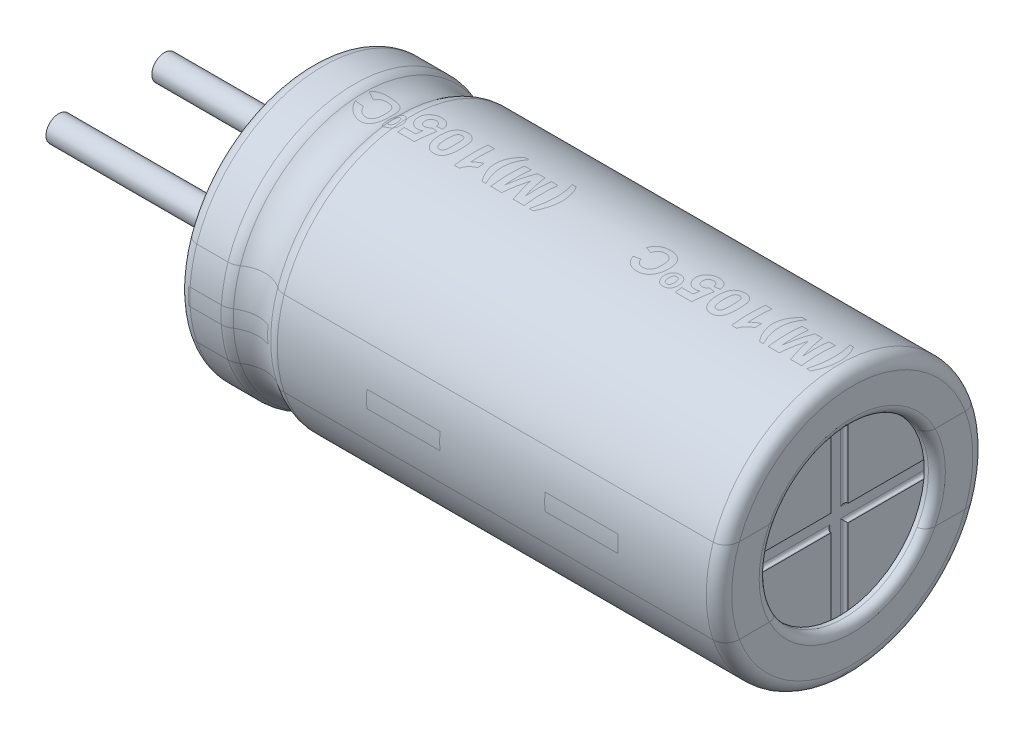
from build123d import *

# Parameters (mm, degrees)
FILLET_1_R          = 0.4
SKETCH_2_R          = 2
CUT_EXTRUDE_1_DEPTH = 0.3
FILLET_2_R          = 0.2
FILLET_3_R          = 0.3
CUT_EXTRUDE_2_DEPTH = 0.1
CUT_EXTRUDE_START   = -0.3
SKETCH_5_R          = 2
CUT_EXTRUDE_3_DEPTH = 0.3
FILLET_6_R          = 0.3
SKETCH_6_R          = 0.3
EXTRUDE_1_DEPTH     = 5
FILLET_7_R          = 0.08


with BuildPart() as part:
    # Эскиз1 → Повернуть1 (revolve)
    with BuildSketch(Plane(origin=(0, 0, 0), x_dir=(1, 0, 0), z_dir=(0, 1, 0)), mode=Mode.PRIVATE) as revolve_1_sk:
        with BuildLine():
            Line((0, 0), (0, 3.15))
            Line((0, 3.15), (1.170849738, 3.15))
            ThreePointArc((1.170849738, 3.15), (1.7, 2.95), (2.229150262, 3.15))
            Line((2.229150262, 3.15), (12.8, 3.15))
            Line((12.8, 3.15), (12.8, 0))
            Line((12.8, 0), (0, 0))
        make_face()
    revolve(revolve_1_sk.sketch.rotate(Axis((-17.233728413, 0, 0), (1, 0, 0)), 180), axis=Axis((-17.233728413, 0, 0), (1, 0, 0)))

    # Скругление1
    fillet_1_edges = [part.edges().sort_by_distance(p)[0] for p in [
        (1.170849738, 0, -3.15),
        (2.229150262, 0, -3.15),
    ]]
    fillet(fillet_1_edges, radius=FILLET_1_R)

    # Эскиз2 → Вырез-Вытянуть1 (cut)
    with BuildSketch(Plane(origin=(12.8, 0, 0), x_dir=(0, 0, -1), z_dir=(1, 0, 0))):
        Circle(SKETCH_2_R)
    extrude(amount=-CUT_EXTRUDE_1_DEPTH, mode=Mode.SUBTRACT)

    # Скругление2
    fillet_2_edges = [part.edges().sort_by_distance(p)[0] for p in [
        (12.8, 0, 2),
    ]]
    fillet(fillet_2_edges, radius=FILLET_2_R)

    # Скругление3
    fillet_3_edges = [part.edges().sort_by_distance(p)[0] for p in [
        (12.8, 0, -3.15),
    ]]
    fillet(fillet_3_edges, radius=FILLET_3_R)

    # Эскиз3 → Вырез-Вытянуть2 (cut)
    with BuildSketch(Plane(origin=(12.5, 0, 0), x_dir=(0, 0, -1), z_dir=(1, 0, 0))):
        with BuildLine():
            Line((-0.2, 2.364762642), (-0.2, 0.2))
            Line((-0.2, 0.2), (-2.364762642, 0.2))
            ThreePointArc((-2.364762642, 0.2), (-2.373205081, 0), (-2.364762642, -0.2))
            Line((-2.364762642, -0.2), (-0.2, -0.2))
            Line((-0.2, -0.2), (-0.2, -2.364762642))
            ThreePointArc((-0.2, -2.364762642), (0, -2.373205081), (0.2, -2.364762642))
            Line((0.2, -2.364762642), (0.2, -0.2))
            Line((0.2, -0.2), (2.364762642, -0.2))
            ThreePointArc((2.364762642, -0.2), (2.373205081, 0), (2.364762642, 0.2))
            Line((2.364762642, 0.2), (0.2, 0.2))
            Line((0.2, 0.2), (0.2, 2.364762642))
            ThreePointArc((0.2, 2.364762642), (0, 2.373205081), (-0.2, 2.364762642))
        make_face()
    extrude(amount=-CUT_EXTRUDE_2_DEPTH, mode=Mode.SUBTRACT)

    # Эскиз5 → Вырез-Вытянуть3 (cut)
    with BuildSketch(Plane.ZY.offset(CUT_EXTRUDE_START)):
        with Locations(Location((0, 0, 0), (0, 0, 185.739170477))):
            Circle(SKETCH_5_R)
    extrude(amount=CUT_EXTRUDE_3_DEPTH, mode=Mode.SUBTRACT)

    # Скругление6
    fillet_6_edges = [part.edges().sort_by_distance(p)[0] for p in [
        (0, 0, -3.15),
        (0, 0.2, 1.989974874),
    ]]
    fillet(fillet_6_edges, radius=FILLET_6_R - 0.0001)  # a hair under: the kernel refuses the full size

    # Эскиз6 → Бобышка-Вытянуть1 (add)
    with BuildSketch(Plane.ZY.offset(-0.3)):
        with Locations((-1.25, 0)):
            Circle(SKETCH_6_R)
        with Locations(Location((1.25, 0, 0), (0, 0, 180))):
            Circle(SKETCH_6_R)
    extrude(amount=EXTRUDE_1_DEPTH)

    # Скругление7
    fillet_7_edges = [part.edges().sort_by_distance(p)[0] for p in [
        (12.4, 1.282381321, -0.2),
        (12.4, 0.2, -1.282381321),
        (12.4, -0.2, -1.282381321),
        (12.4, -1.282381321, -0.2),
        (12.4, -1.282381321, 0.2),
        (12.4, -0.2, 1.282381321),
        (12.4, 0.2, 1.282381321),
        (12.4, 1.282381321, 0.2),
    ]]
    fillet(fillet_7_edges, radius=FILLET_7_R)


solid = part.part
